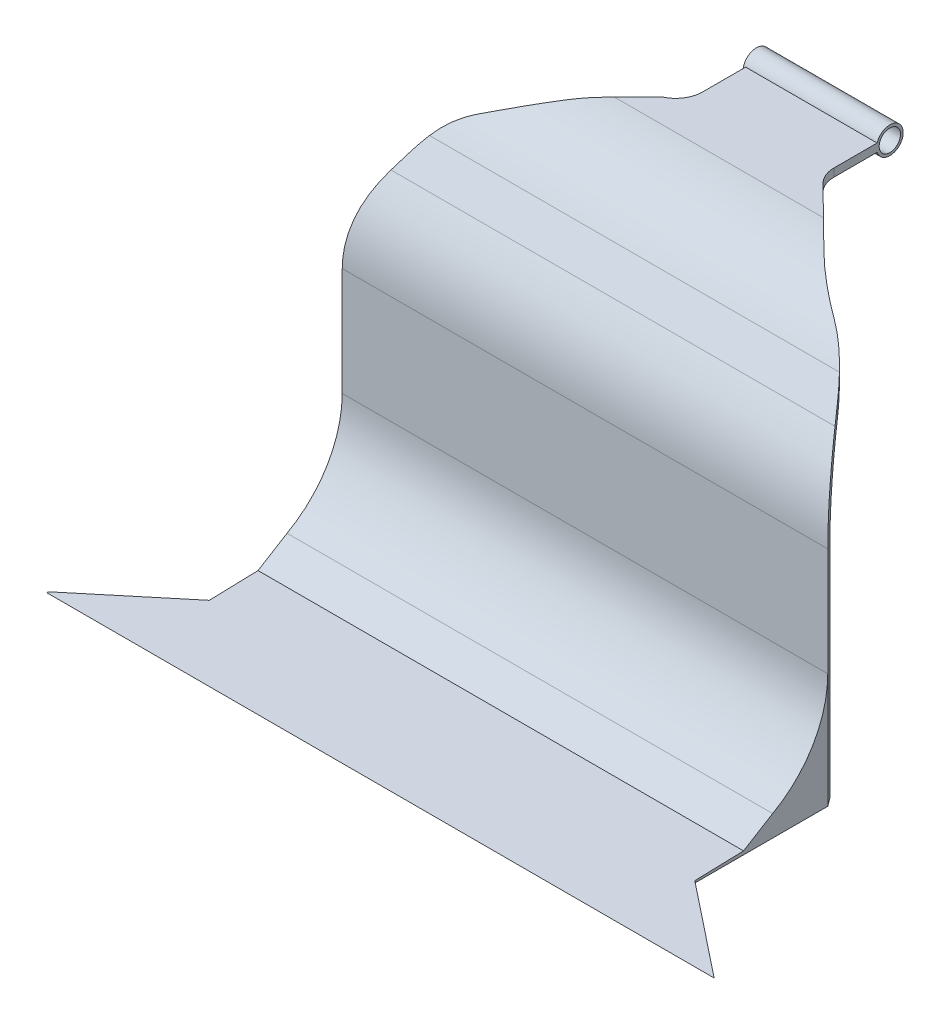
from build123d import *

# Parameters (mm, degrees)
BOSS_EXTRUDE1_DEPTH     = 250
FILLET1_R               = 40
SKETCH13_W              = 49.257086068
SKETCH13_H              = 61.833319097
BOSS_EXTRUDE5_DEPTH     = 3
SKETCH14_R              = 5
SKETCH14_R_2            = 4
BOSS_EXTRUDE6_DEPTH     = 50
SKETCH15_R              = 4
CUT_EXTRUDE5_DEPTH      = 50
FILLET5_R               = 10
CUT_EXTRUDE6_DEPTH      = 326.916158871
CUT_EXTRUDE6_DEPTH_BACK = 326.916158871
CUT_EXTRUDE7_DEPTH      = 301.326149824
CUT_EXTRUDE7_DEPTH_BACK = 301.326149824
FILLET6_R               = 50
FILLET7_R               = 50
FILLET8_R               = 50
FILLET9_R               = 50
FILLET10_R              = 50
FILLET11_R              = 100
FILLET12_START          = 43.99041169
FILLET12_DEPTH          = 161.276262689


with BuildPart() as part:
    # Sketch1 → Boss-Extrude1 (new body)
    with BuildSketch(Plane(origin=(0, 0, 0), x_dir=(0, 0, -1), z_dir=(1, 0, 0))):
        Polygon((84.922374429, -7.245973585), (84.922374429, -104.869861266), (7.922374429, -104.869861266), (7.922374429, -107.869861266), (87.922374429, -107.869861266), (87.922374429, -8.272692249), (116.920297026, 29.130138734), (143.207419357, 29.130138734), (143.207419357, 32.130138734), (115.450156075, 32.130138734), align=None)
    extrude(amount=BOSS_EXTRUDE1_DEPTH)

    # Fillet1
    fillet1_edges = [part.edges().sort_by_distance(p)[0] for p in [
        (125, -104.869861266, -84.922374429),
    ]]
    fillet(fillet1_edges, radius=FILLET1_R)

    # Sketch13 → Boss-Extrude5 (add)
    with BuildSketch(Plane(origin=(0, 32.130138734, 0), x_dir=(1, 0, 0), z_dir=(0, 1, 0))):
        with Locations((125, 143.207419358)):
            Rectangle(SKETCH13_W, SKETCH13_H)
    extrude(amount=-BOSS_EXTRUDE5_DEPTH)

    # Sketch14 → Boss-Extrude6 (add)
    with BuildSketch(Plane(origin=(149.628543034, 0, 0), x_dir=(0, 0, -1), z_dir=(1, 0, 0))):
        with Locations((174.124078906, 30.630138734)):
            Circle(SKETCH14_R)
        with Locations((174.124078906, 30.630138734)):
            Circle(SKETCH14_R_2, mode=Mode.SUBTRACT)
    extrude(amount=-BOSS_EXTRUDE6_DEPTH)

    # Sketch15 → Cut-Extrude5 (cut)
    with BuildSketch(Plane(origin=(149.628543034, 0, 0), x_dir=(0, 0, -1), z_dir=(1, 0, 0))):
        with Locations((174.124078906, 30.630138734)):
            Circle(SKETCH15_R)
    extrude(amount=-CUT_EXTRUDE5_DEPTH, mode=Mode.SUBTRACT)

    # Fillet5
    fillet5_edges = [part.edges().sort_by_distance(p)[0] for p in [
        (149.628543034, 30.630138734, -143.207419357),
        (100.371456966, 30.630138734, -143.207419357),
    ]]
    fillet(fillet5_edges, radius=FILLET5_R)

    # Sketch16 → Cut-Extrude6 (cut, two sides: drawn at the far end of the back side and taken through both)
    with BuildSketch(Plane(origin=(0, 0, 0), x_dir=(1, 0, 0), z_dir=(0, 1, 0)).offset(-CUT_EXTRUDE6_DEPTH_BACK)):
        Polygon((152.557475223, 146.136351545), (183.758090757, 115.450156075), (192.952340186, 115.450156075), (215.579344221, 84.922374429), (215.579344221, 35.113164703), (250, 7.922374429), (290.889121347, 148.865149358), (190.317133447, 171.001918434), align=None)
        Polygon((56.304745883, 115.450156075), (65.498995311, 115.450156075), (96.699610846, 146.136351545), (58.939952622, 171.001918434), (-41.632035279, 148.865149358), (-0.742913931, 7.922374429), (33.677741848, 35.113164703), (33.677741848, 84.922374429), align=None)
    extrude(amount=CUT_EXTRUDE6_DEPTH + CUT_EXTRUDE6_DEPTH_BACK, mode=Mode.SUBTRACT)

    # Sketch20 → Cut-Extrude7 (cut, two sides: drawn at the far end of the back side and taken through both)
    with BuildSketch(Plane(origin=(215.579344221, 0, 0), x_dir=(0, 0, -1), z_dir=(1, 0, 0)).offset(-CUT_EXTRUDE7_DEPTH_BACK)):
        Polygon((7.922374429, -107.869861266), (53.377825638, -106.568275865), (64.247416618, -99.891893537), (2.905628415, -97.28009186), (4.033474998, -102.693755458), align=None)
    extrude(amount=CUT_EXTRUDE7_DEPTH + CUT_EXTRUDE7_DEPTH_BACK, mode=Mode.SUBTRACT)

    # Fillet6
    fillet6_edges = [part.edges().sort_by_distance(p)[0] for p in [
        (124.628543034, -7.245973585, -84.922374429),
    ]]
    fillet(fillet6_edges, radius=FILLET6_R)

    # Fillet7
    fillet7_edges = [part.edges().sort_by_distance(p)[0] for p in [
        (124.628543034, -8.272692249, -87.922374429),
    ]]
    fillet(fillet7_edges, radius=FILLET7_R)

    # Fillet8
    fillet8_edges = [part.edges().sort_by_distance(p)[0] for p in [
        (124.628543034, 29.130138734, -116.920297026),
    ]]
    fillet(fillet8_edges, radius=FILLET8_R)

    # Fillet9
    # the kernel refuses this fillet: 50 mm, written as the material it takes off along each edge
    with BuildSketch(Plane(origin=(192.952340186, -29.84551843, -115.450156075), x_dir=(0.5954625750047567, 0, 0.8033830479719526), z_dir=(0, 1, 0))) as fillet9_piece_1:
        with BuildLine():
            CenterArc((20.680282204, -50), FILLET9_R, 90, 31.540576836)
            Line((-5.47483144, -7.38650413), (0, 0))
            Line((0, 0), (20.680282204, 0))
        make_face()
    extrude(amount=113.676362673, mode=Mode.SUBTRACT)

    # Fillet10
    # the kernel refuses this fillet: 50 mm, written as the material it takes off along each edge
    with BuildSketch(Plane(origin=(56.304745883, 83.830844243, -115.450156075), x_dir=(-0.5954625750047574, 0, 0.8033830479719519), z_dir=(0, -1, 0))) as fillet10_piece_1:
        with BuildLine():
            CenterArc((20.680282204, -50), FILLET10_R, 90, 31.540576836)
            Line((-5.47483144, -7.38650413), (0, 0))
            Line((0, 0), (20.680282204, 0))
        make_face()
    extrude(amount=113.676362673, mode=Mode.SUBTRACT)

    # Fillet11
    fillet11_edges = [part.edges().sort_by_distance(p)[0] for p in [
        (65.498995311, 26.992662907, -115.450156075),
        (183.758090757, 26.992662907, -115.450156075),
    ]]
    fillet(fillet11_edges, radius=FILLET11_R)

    # Fillet12: read off the stored shape, not the designer's step
    # Fillet12 outline → Fillet12 (cut)
    with BuildSketch(Plane.YZ.offset(FILLET12_START)):
        with BuildLine():
            Line((29.130138734, -113.124295559), (16.638670002, -103.439824252))
            ThreePointArc((16.638670002, -103.439824252), (28.049083949, -117.450064663), (32.130138734, -135.052035423))
            Line((32.130138734, -135.052035423), (32.130138734, -112.290759809))
            Line((32.130138734, -112.290759809), (29.130138734, -112.290759809))
            Line((29.130138734, -112.290759809), (29.130138734, -113.124295559))
        make_face()
    extrude(amount=FILLET12_DEPTH, mode=Mode.SUBTRACT)


solid = part.part
